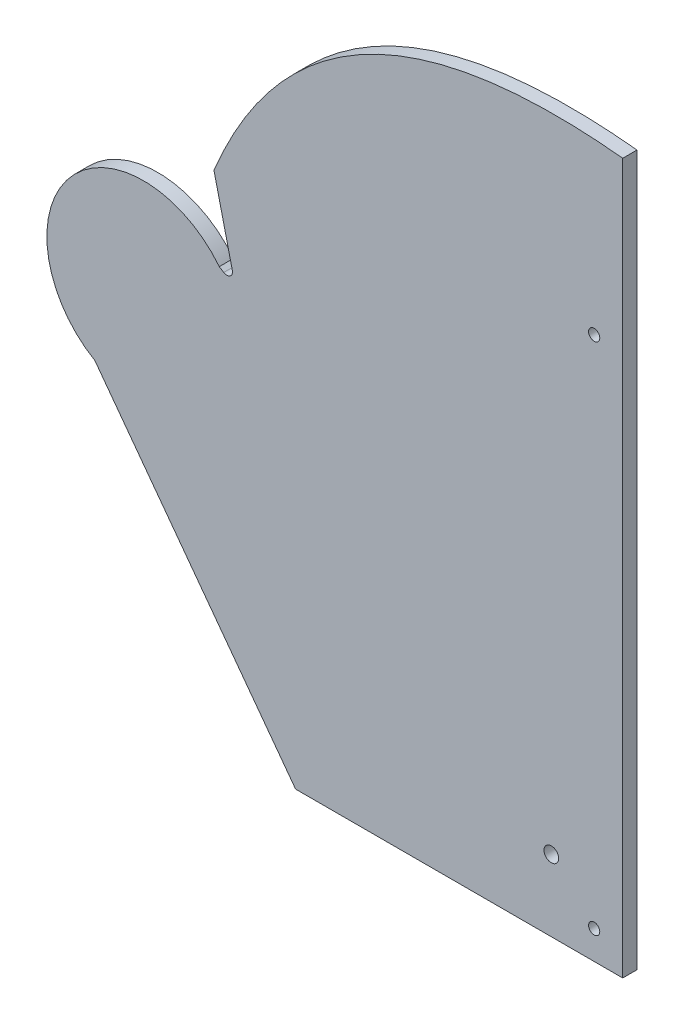
from build123d import *

# Parameters (mm, degrees)
SKETCH1_W                   = 609.6
SKETCH1_H                   = 406.4
BOSS_EXTRUDE1_DEPTH         = 6.35
F_10_CLEARANCE_HOLE1_D      = 4.9784
F_10_CLEARANCE_HOLE1_DEPTH  = 10.16
F_10_CLEARANCE_HOLE1_TIP    = 1.495662253
F_1_4_CLEARANCE_HOLE1_D     = 6.5278
F_1_4_CLEARANCE_HOLE1_DEPTH = 10.16
F_1_4_CLEARANCE_HOLE1_TIP   = 1.961148974
CUT_EXTRUDE8_DEPTH          = 733.675536988


with BuildPart() as part:
    # Sketch1 → Boss-Extrude1 (new body)
    with BuildSketch(Plane.XY):
        with Locations((304.8, 203.2)):
            Rectangle(SKETCH1_W, SKETCH1_H)
    extrude(amount=BOSS_EXTRUDE1_DEPTH)

    # #10 Clearance Hole1
    with Locations(Plane.XY.offset(6.35)):
        with Locations((393.7, 12.7), (304.8, 203.2), (596.9, 393.7), (12.7, 12.7), (12.7, 393.7), (596.9, 12.7), (304.8, 330.2), (304.8, 76.2), (596.9, 241.3)):
            Hole(F_10_CLEARANCE_HOLE1_D / 2, depth=F_10_CLEARANCE_HOLE1_DEPTH)
            with Locations((0, 0, -(F_10_CLEARANCE_HOLE1_DEPTH + F_10_CLEARANCE_HOLE1_TIP / 2))):  # 118° drill point
                Cone(0, F_10_CLEARANCE_HOLE1_D / 2, F_10_CLEARANCE_HOLE1_TIP, mode=Mode.SUBTRACT)

    # 1/4 Clearance Hole1
    with Locations(Plane.XY.offset(6.35)):
        with Locations((577.85, 31.75), (304.8, 203.2), (577.85, 374.65), (31.75, 31.75), (31.75, 374.65)):
            Hole(F_1_4_CLEARANCE_HOLE1_D / 2, depth=F_1_4_CLEARANCE_HOLE1_DEPTH)
            with Locations((0, 0, -(F_1_4_CLEARANCE_HOLE1_DEPTH + F_1_4_CLEARANCE_HOLE1_TIP / 2))):  # 118° drill point
                Cone(0, F_1_4_CLEARANCE_HOLE1_D / 2, F_1_4_CLEARANCE_HOLE1_TIP, mode=Mode.SUBTRACT)

    # Sketch16 → Cut-Extrude8 (cut, through all)
    with BuildSketch(Plane.XY):
        with BuildLine():
            Line((374.94214445, 120.366314217), (464.147590573, 0))
            Line((464.147590573, 0), (0, 0))
            Line((0, 0), (0, 406.4))
            Line((0, 406.4), (609.6, 406.4))
            Line((609.6, 406.4), (609.6, 315.642514433))
            add(Edge.make_bspline(
                [(427.858743628, 220.125105136), (458.015650894, 293.232913116), (518.596069685, 325.072049548), (609.6, 315.642514433)],
                knots=[0.107898544, 0.107898544, 0.107898544, 0.107898544, 1, 1, 1, 1], degree=3))
            Line((427.858743628, 220.125105136), (436.026340822, 185.687724137))
            ThreePointArc((436.026340822, 185.687724137), (435.029795501, 183.033648863), (432.195867807, 182.955726092))
            Line((432.195867807, 182.955726092), (430.214744011, 184.210437829))
            ThreePointArc((430.214744011, 184.210437829), (364.056908604, 185.638123701), (374.94214445, 120.366314217))
        make_face()
    extrude(amount=CUT_EXTRUDE8_DEPTH, mode=Mode.SUBTRACT)


solid = part.part
